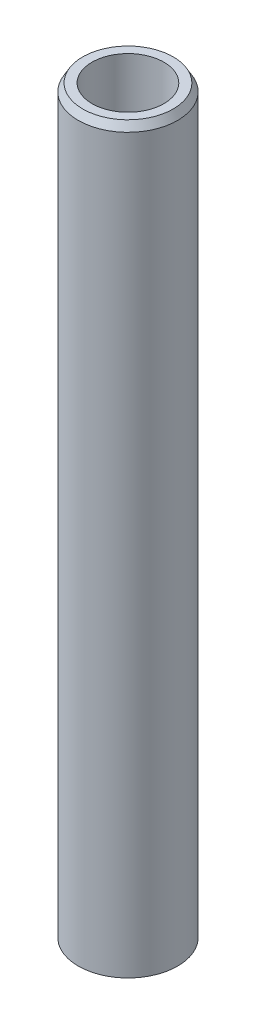
from build123d import *
from OCP.BRepFilletAPI import BRepFilletAPI_MakeChamfer

# Parameters (mm, degrees)
SKETCH1_R           = 15
BOSS_EXTRUDE1_DEPTH = 224.91857225
SKETCH2_R           = 10.866316906
CUT_EXTRUDE1_DEPTH  = 226.916719485
CHAMFER1_SIZE       = 2.324178125
CHAMFER1_SIZE2      = 1.341864866


with BuildPart() as part:
    # Sketch1 → Boss-Extrude1 (new body)
    with BuildSketch(Plane(origin=(0, 0, 0), x_dir=(1, 0, 0), z_dir=(0, 1, 0))):
        Circle(SKETCH1_R)
    extrude(amount=BOSS_EXTRUDE1_DEPTH)

    # Sketch2 → Cut-Extrude1 (cut, through all)
    with BuildSketch(Plane(origin=(0, 0, 0), x_dir=(1, 0, 0), z_dir=(0, 1, 0))):
        Circle(SKETCH2_R)
    extrude(amount=CUT_EXTRUDE1_DEPTH, mode=Mode.SUBTRACT)

    # Chamfer1: one chamfer whose edges measure the first distance from different faces: ONE call of the kernel's chamfer builder (chamfer() names one face for all edges)
    chamfer1_edges_1 = [part.edges().sort_by_distance(p)[0] for p in [
        (-15, 224.91857225, 0),
    ]]
    chamfer1_side_1 = [part.faces().sort_by_distance(p)[0] for p in [
        (-15, 112.459286125, 0),
    ]]
    chamfer1_edges_2 = [part.edges().sort_by_distance(p)[0] for p in [
        (-15, 0, 0),
    ]]
    chamfer1_side_2 = [part.faces().sort_by_distance(p)[0] for p in [
        (-14.575735931, 0, 0),
    ]]
    chamfer1 = BRepFilletAPI_MakeChamfer(part.part.solid().wrapped)
    for e in chamfer1_edges_1:
        chamfer1.Add(CHAMFER1_SIZE, CHAMFER1_SIZE2, e.wrapped, chamfer1_side_1[0].wrapped)  # the first distance lies on this face
    for e in chamfer1_edges_2:
        chamfer1.Add(CHAMFER1_SIZE, CHAMFER1_SIZE2, e.wrapped, chamfer1_side_2[0].wrapped)  # the first distance lies on this face
    add(Compound.cast(chamfer1.Shape()), mode=Mode.REPLACE)


solid = part.part
